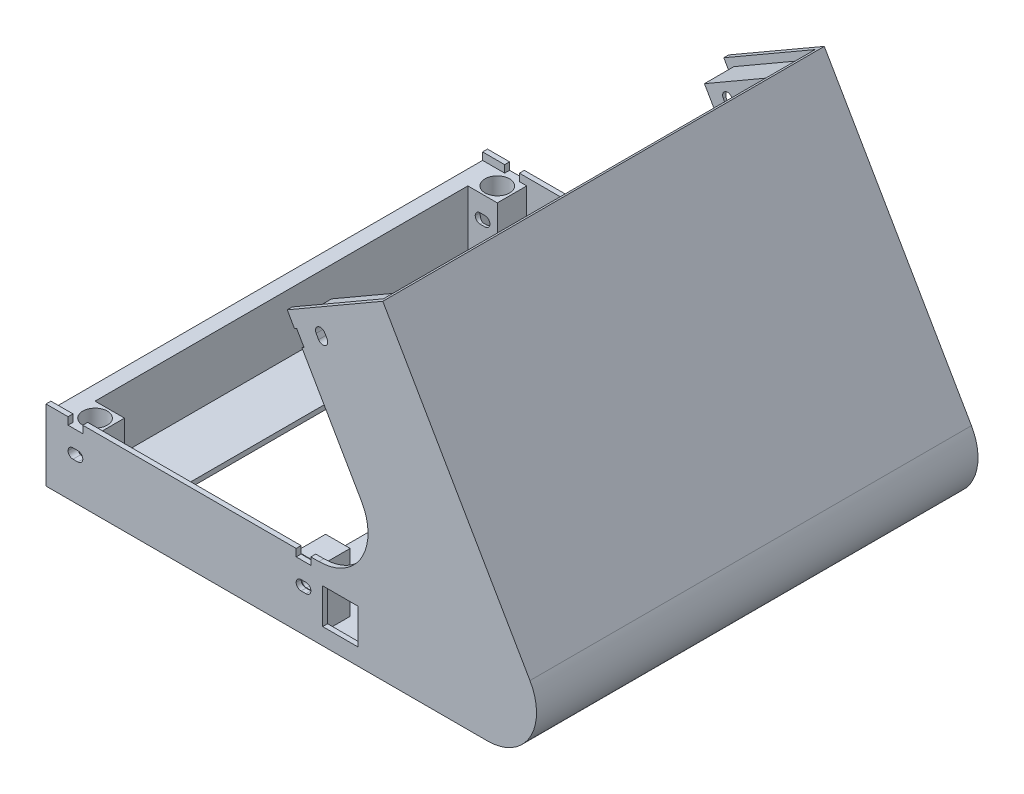
from build123d import *

# Parameters (mm, degrees)
FRONTPLATE_DEPTH                = 90
SZKIC2_W                        = 27
SZKIC2_H                        = 71
SCREEN_HD44780_DEPTH            = 124.958937032
SZKIC3_W                        = 6
SZKIC3_H                        = 6
SZKIC3_W_2                      = 5
SZKIC3_H_2                      = 5.9
MOUNTINGPOINTS_DEPTH            = 12
SZKIC4_R                        = 2.5
WYTNIJ_WYCI_GNI_CIE2_DEPTH      = 10
DODANIE_WYCI_GNI_CIE3_DEPTH     = 1
SZKIC6_W                        = 3
SZKIC6_H                        = 90
DODANIE_WYCI_GNI_CIE4_DEPTH     = 12
SZYK_LINIOWY1_COUNT             = 2
SZYK_LINIOWY1_PITCH             = 89
WYTNIJ_WYCI_GNI_CIE3_DEPTH      = 125.493940087
WYTNIJ_WYCI_GNI_CIE3_DEPTH_BACK = 125.493940087
SZKIC7_W                        = 3
SZKIC7_H                        = 2
SZKIC7_H_2                      = 1.5
SZKIC8_W                        = 6
SZKIC8_H                        = 6
SZKIC8_R                        = 2.5
MOUNTINGPOINTS2_DEPTH           = 20
WYTNIJ_WYCI_GNI_CIE4_DEPTH      = 125.493940087
WYTNIJ_WYCI_GNI_CIE4_DEPTH_BACK = 125.493940087
WYTNIJ_WYCI_GNI_CIE5_DEPTH      = 125.493940087
WYTNIJ_WYCI_GNI_CIE5_DEPTH_BACK = 125.493940087
SZKIC11_W                       = 7.2
SZKIC11_H                       = 7.2
WYTNIJ_WYCI_GNI_CIE6_DEPTH      = 20
DODANIE_WYCI_GNI_CIE6_REACH     = 121.531
ZAOKR_GLENIE1_R                 = 1


with BuildPart() as part:
    # Szkic1 → FrontPlate (new body)
    with BuildSketch(Plane.XY):
        with BuildLine():
            Line((-53.989771176, 0), (36.010228824, 0))
            ThreePointArc((36.010228824, 0), (44.670482862, 5), (44.670482862, 15))
            Line((44.670482862, 15), (14.670482862, 66.961524227))
            Line((14.670482862, 66.961524227), (13.804457458, 66.461524227))
            Line((13.804457458, 66.461524227), (43.804457458, 14.5))
            ThreePointArc((43.804457458, 14.5), (43.804457458, 5.5), (36.010228824, 1))
            Line((36.010228824, 1), (-53.989771176, 1))
            Line((-53.989771176, 1), (-53.989771176, 0))
        make_face()
    extrude(amount=FRONTPLATE_DEPTH)

    # Szkic2 → Screen_hd44780 (cut, through all)
    with BuildSketch(Plane(origin=(0, 1, 0), x_dir=(1, 0, 0), z_dir=(0, 1, 0))):
        with Locations((-25.489771176, -45)):
            Rectangle(SZKIC2_W, SZKIC2_H)
    extrude(amount=-SCREEN_HD44780_DEPTH, mode=Mode.SUBTRACT)

    # Szkic3 → MountingPoints (add)
    with BuildSketch(Plane(origin=(0, 1, 0), x_dir=(1, 0, 0), z_dir=(0, 1, 0))):
        with Locations((-47.989771176, -4)):
            Rectangle(SZKIC3_W, SZKIC3_H)
        with Locations((-47.989771176, -86)):
            Rectangle(SZKIC3_W, SZKIC3_H)
        with Locations((-1.489771176, -85.95)):
            Rectangle(SZKIC3_W_2, SZKIC3_H_2)
        with Locations((-1.489771176, -4.05)):
            Rectangle(SZKIC3_W_2, SZKIC3_H_2)
    extrude(amount=MOUNTINGPOINTS_DEPTH)

    # Szkic4 → Wytnij-wyciągnięcie2 (cut)
    with BuildSketch(Plane(origin=(0, 13, 0), x_dir=(1, 0, 0), z_dir=(0, 1, 0))):
        with Locations(Location((-47.989771176, -4, 0), (0, 0, 270))):
            Circle(SZKIC4_R)
        with Locations(Location((-47.989771176, -86, 0), (0, 0, 90))):
            Circle(SZKIC4_R)
    extrude(amount=-WYTNIJ_WYCI_GNI_CIE2_DEPTH, mode=Mode.SUBTRACT)

    # Szkic6 → Dodanie-wyciągnięcie4 (add)
    with BuildSketch(Plane(origin=(0, 1, 0), x_dir=(1, 0, 0), z_dir=(0, 1, 0))):
        with Locations((-52.489771176, -45)):
            Rectangle(SZKIC6_W, SZKIC6_H)
    extrude(amount=DODANIE_WYCI_GNI_CIE4_DEPTH)


with BuildPart() as body_2:
    # Szkic5 → Dodanie-wyciągnięcie3 (new body)
    with BuildSketch(Plane.XY.offset(90)):
        with BuildLine():
            Line((-53.989771176, 1), (-53.989771176, 14.5))
            Line((-53.989771176, 14.5), (1.657887807, 14.5))
            ThreePointArc((1.657887807, 14.5), (10.318141845, 19.5), (10.318141845, 29.5))
            Line((10.318141845, 29.5), (-4.815088724, 55.711524227))
            Line((-4.815088724, 55.711524227), (13.804457458, 66.461524227))
            Line((13.804457458, 66.461524227), (43.804457458, 14.5))
            ThreePointArc((43.804457458, 14.5), (43.804457458, 5.5), (36.010228824, 1))
            Line((36.010228824, 1), (-53.989771176, 1))
        make_face()
    dodanie_wyci_gni_cie3 = extrude(amount=-DODANIE_WYCI_GNI_CIE3_DEPTH)


with BuildPart() as szyk_liniowy1_1:
    # Szyk liniowy1: Dodanie-wyciągnięcie3 ×2
    with Locations(*[(0, 0, -i * SZYK_LINIOWY1_PITCH) for i in range(1, SZYK_LINIOWY1_COUNT)]):
        add(dodanie_wyci_gni_cie3)


with BuildPart() as wytnij_wyci_gni_cie3_tool:
    # Szkic7 → Wytnij-wyciągnięcie3 (new, two sides: drawn at the far end of the back side and taken through both)
    with BuildSketch(Plane.XY.offset(90).offset(-WYTNIJ_WYCI_GNI_CIE3_DEPTH_BACK)):
        with Locations((-47.989771176, 8.5)):
            Rectangle(SZKIC7_W, SZKIC7_H)
        with Locations((-47.989771176, 13.75)):
            Rectangle(SZKIC7_W, SZKIC7_H_2)
        with Locations((-1.489771176, 8.5)):
            Rectangle(SZKIC7_W, SZKIC7_H)
        with Locations((-1.489771176, 13.75)):
            Rectangle(SZKIC7_W, SZKIC7_H_2)
    extrude(amount=WYTNIJ_WYCI_GNI_CIE3_DEPTH + WYTNIJ_WYCI_GNI_CIE3_DEPTH_BACK)


with BuildPart() as part_1:
    add(part.part)

    # Wytnij-wyciągnięcie3: cut by wytnij_wyci_gni_cie3_tool
    add(wytnij_wyci_gni_cie3_tool.part, mode=Mode.SUBTRACT)



with BuildPart() as body_2_1:
    add(body_2.part)

    # Wytnij-wyciągnięcie3: cut by wytnij_wyci_gni_cie3_tool
    add(wytnij_wyci_gni_cie3_tool.part, mode=Mode.SUBTRACT)


with BuildPart() as szyk_liniowy1_1_1:
    add(szyk_liniowy1_1.part)

    # Wytnij-wyciągnięcie3: cut by wytnij_wyci_gni_cie3_tool
    add(wytnij_wyci_gni_cie3_tool.part, mode=Mode.SUBTRACT)


with BuildPart() as part_2:
    add(part_1.part)

    add(body_2_1.part)  # MountingPoints2 merges body 2

    add(szyk_liniowy1_1_1.part)  # MountingPoints2 merges Szyk liniowy1_1
    # Szkic8 → MountingPoints2 (add)
    # profile 1 of 2: a face of its own
    with BuildSketch(Plane(origin=(39.132027271, 22.592886479, 0), x_dir=(0, 0, 1), z_dir=(-0.8660254037844363, -0.5000000000000042, 0))):
        with Locations((86, 46.155139626)):
            Rectangle(SZKIC8_W, SZKIC8_H)
        with Locations(Location((86, 46.155139626, 0), (0, 0, 270))):
            Circle(SZKIC8_R, mode=Mode.SUBTRACT)
    # profile 2 of 2: a face of its own
    with BuildSketch(Plane(origin=(39.132027271, 22.592886479, 0), x_dir=(0, 0, 1), z_dir=(-0.8660254037844363, -0.5000000000000042, 0))):
        with Locations((4, 46.155139626)):
            Rectangle(SZKIC8_W, SZKIC8_H)
        with Locations(Location((4, 46.155139626, 0), (0, 0, 90))):
            Circle(SZKIC8_R, mode=Mode.SUBTRACT)
    extrude(amount=MOUNTINGPOINTS2_DEPTH)

    # Szkic9 → Wytnij-wyciągnięcie4 (cut, two sides: drawn at the far end of the back side and taken through both)
    with BuildSketch(Plane(origin=(0, 0, 0), x_dir=(-1, 0, 0), z_dir=(0, 0, -1)).offset(-WYTNIJ_WYCI_GNI_CIE4_DEPTH_BACK)):
        Polygon((-0.582025593, 55.363448016), (-2.314076401, 56.363448016), (-3.814076401, 53.765371804), (-2.082025593, 52.765371804), align=None)
    extrude(amount=WYTNIJ_WYCI_GNI_CIE4_DEPTH + WYTNIJ_WYCI_GNI_CIE4_DEPTH_BACK, mode=Mode.SUBTRACT)

    # Szkic10 → Wytnij-wyciągnięcie5 (cut, two sides: drawn at the far end of the back side and taken through both)
    with BuildSketch(Plane(origin=(0, 0, 0), x_dir=(-1, 0, 0), z_dir=(0, 0, -1)).offset(-WYTNIJ_WYCI_GNI_CIE5_DEPTH_BACK)):
        Polygon((3.315088724, 53.113448016), (2.882076022, 53.363448016), (1.382076022, 50.765371804), (1.815088724, 50.515371804), align=None)
    extrude(amount=WYTNIJ_WYCI_GNI_CIE5_DEPTH + WYTNIJ_WYCI_GNI_CIE5_DEPTH_BACK, mode=Mode.SUBTRACT)

    # Szkic11 → Wytnij-wyciągnięcie6 (cut)
    with BuildSketch(Plane(origin=(0, 0, 89), x_dir=(-1, 0, 0), z_dir=(0, 0, -1))):
        with Locations((-6.010228824, 7)):
            Rectangle(SZKIC11_W, SZKIC11_H)
    extrude(amount=-WYTNIJ_WYCI_GNI_CIE6_DEPTH, mode=Mode.SUBTRACT)

    # Szkic12 → Dodanie-wyciągnięcie6 (add, up to next)
    with BuildSketch(Plane(origin=(0, 0, 83), x_dir=(-1, 0, 0), z_dir=(0, 0, -1)), mode=Mode.PRIVATE) as dodanie_wyci_gni_cie6_sk1:
        with BuildLine():
            Line((-0.233949382, 49.966333699), (-17.554457458, 59.966333699))
            Line((-17.554457458, 59.966333699), (-43.804457458, 14.5))
            ThreePointArc((-43.804457458, 14.5), (-43.804457458, 5.5), (-36.010228824, 1))
            Line((-36.010228824, 1), (-0.233949382, 49.966333699))
        make_face()
    dodanie_wyci_gni_cie6_tool1 = extrude(dodanie_wyci_gni_cie6_sk1.sketch, amount=-DODANIE_WYCI_GNI_CIE6_REACH, mode=Mode.PRIVATE) - part_2.part
    dodanie_wyci_gni_cie6 = dodanie_wyci_gni_cie6_tool1.solids().sort_by_distance((24.208008, 31.328077, 83))[0]
    add(dodanie_wyci_gni_cie6)

    # Lustro2: Dodanie-wyciągnięcie6 across plane
    add(dodanie_wyci_gni_cie6.mirror(Plane.XY.offset(45)))

    # Zaokrąglenie1
    zaokr_glenie1_edges = [part_2.edges().sort_by_distance(p)[0] for p in [
        (-2.989771176, 7.5, 0.5),
        (-2.989771176, 7.5, 4.05),
        (-2.989771176, 9.5, 4.05),
        (-2.989771176, 9.5, 0.5),
        (0.010228824, 9.5, 0.5),
        (0.010228824, 9.5, 4.05),
        (0.010228824, 7.5, 0.5),
        (0.010228824, 7.5, 4.05),
        (-2.989771176, 9.5, 85.95),
        (-2.989771176, 7.5, 85.95),
        (0.010228824, 7.5, 85.95),
        (0.010228824, 9.5, 85.95),
        (0.010228824, 7.5, 89.5),
        (0.010228824, 9.5, 89.5),
        (-2.989771176, 9.5, 89.5),
        (-2.989771176, 7.5, 89.5),
        (2.082025593, 52.765371804, 83.5),
        (2.082025593, 52.765371804, 89),
        (3.814076401, 53.765371804, 83.5),
        (3.814076401, 53.765371804, 89),
        (2.314076401, 56.363448016, 83.5),
        (2.314076401, 56.363448016, 89),
        (0.582025593, 55.363448016, 83.5),
        (0.582025593, 55.363448016, 89),
        (0.582025593, 55.363448016, 6.5),
        (2.314076401, 56.363448016, 6.5),
        (2.082025593, 52.765371804, 6.5),
        (3.814076401, 53.765371804, 6.5),
        (2.082025593, 52.765371804, 1),
        (0.582025593, 55.363448016, 1),
        (2.314076401, 56.363448016, 1),
        (3.814076401, 53.765371804, 1),
        (-49.489771176, 7.5, 6.5),
        (-49.489771176, 7.5, 1),
        (-49.489771176, 7.5, 83.5),
        (-49.489771176, 7.5, 89),
        (-49.489771176, 9.5, 6.5),
        (-49.489771176, 9.5, 1),
        (-49.489771176, 9.5, 83.5),
        (-49.489771176, 9.5, 89),
        (-46.489771176, 9.5, 6.5),
        (-46.489771176, 9.5, 1),
        (-46.489771176, 9.5, 83.5),
        (-46.489771176, 9.5, 89),
        (-46.489771176, 7.5, 83.5),
        (-46.489771176, 7.5, 6.5),
        (-46.489771176, 7.5, 1),
        (-46.489771176, 7.5, 89),
    ]]
    fillet(zaokr_glenie1_edges, radius=ZAOKR_GLENIE1_R - 0.0001)  # a hair under: the kernel refuses the full size


solid = part_2.part
